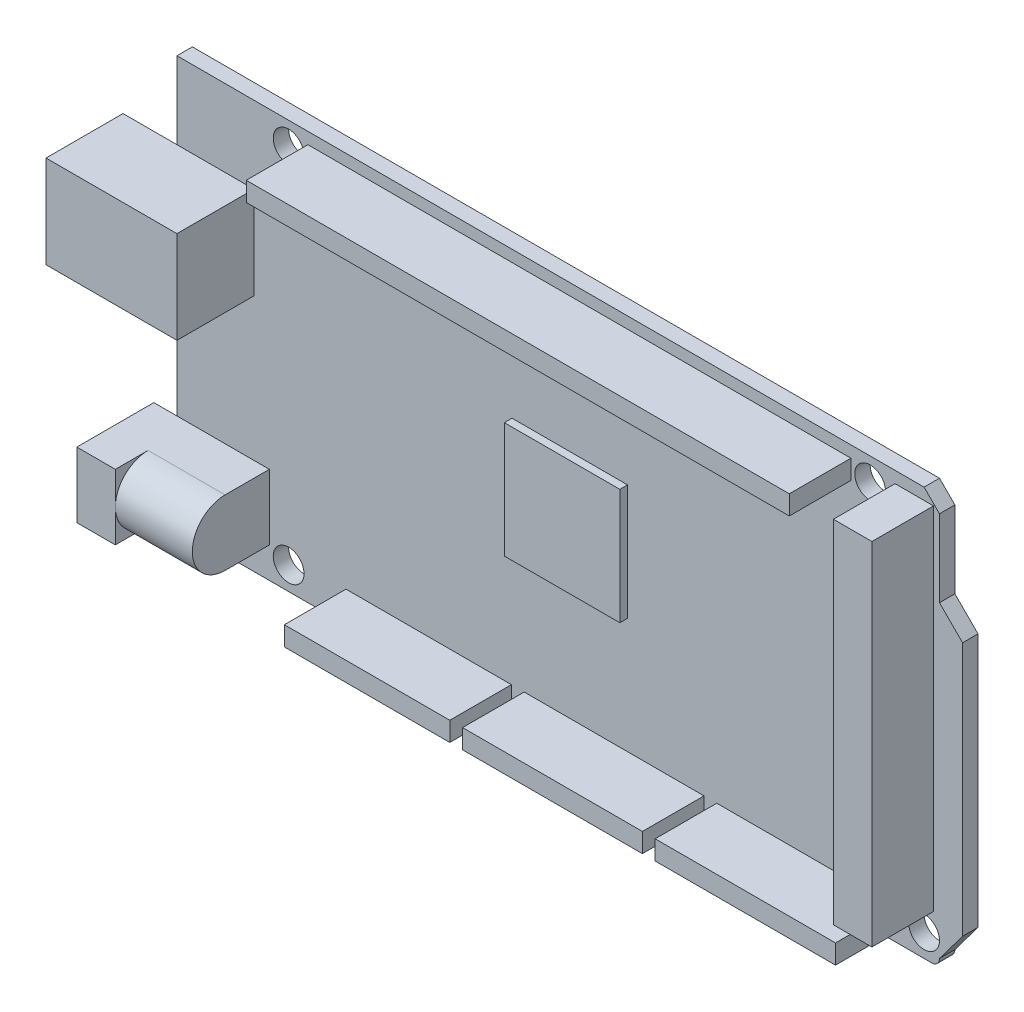
from build123d import *

# Parameters (mm, degrees)
SKETCH_2_W          = 102
SKETCH_2_H          = 53
EXTRUDE_1_DEPTH     = 2
CUT_EXTRUDE_1_DEPTH = 2
SKETCH_4_R          = 2
CUT_EXTRUDE_2_DEPTH = 2
FILLET_1_R          = 1
SKETCH_5_R          = 2
CUT_EXTRUDE_3_DEPTH = 2
SKETCH_6_W          = 17
SKETCH_6_H          = 12
EXTRUDE_2_DEPTH     = 10
SKETCH_7_W          = 70.5
SKETCH_7_H          = 2.5
SKETCH_7_W_2        = 5
SKETCH_7_H_2        = 45.597878471
SKETCH_7_W_3        = 71.552945179
EXTRUDE_3_DEPTH     = 8
SKETCH_8_W          = 15
SKETCH_8_H          = 15
EXTRUDE_4_DEPTH     = 1
SKETCH_9_W          = 1.65475178
SKETCH_9_H          = 2.5
CUT_EXTRUDE_4_DEPTH = 8
SKETCH_10_W         = 15
SKETCH_10_H         = 8.5
EXTRUDE_5_DEPTH     = 10
CUT_EXTRUDE_5_DEPTH = 10
SKETCH_12_R         = 3
SKETCH_12_R_2       = 0.5
CUT_EXTRUDE_6_DEPTH = 11
SKETCH_13_W         = 3
SKETCH_13_H         = 4
CUT_EXTRUDE_7_DEPTH = 11


with BuildPart() as part:
    # 草图2 → 凸台-拉伸1 (new body)
    with BuildSketch(Plane.XY):
        Rectangle(SKETCH_2_W, SKETCH_2_H)
    extrude(amount=EXTRUDE_1_DEPTH)

    # 草图3 → 切除-拉伸1 (cut)
    with BuildSketch(Plane.XY.offset(2)):
        Polygon((51, 11.5), (48, 14.5), (48, 24.5), (46, 26.5), (51, 26.5), align=None)
        Polygon((51, -21.5), (48, -25.5), (48, -26.5), (51, -26.5), align=None)
    extrude(amount=-CUT_EXTRUDE_1_DEPTH, mode=Mode.SUBTRACT)

    # 草图4 → 切除-拉伸2 (cut)
    with BuildSketch(Plane.XY.offset(2)):
        with Locations((46, -23.5)):
            Circle(SKETCH_4_R)
    extrude(amount=-CUT_EXTRUDE_2_DEPTH, mode=Mode.SUBTRACT)

    # 圆角1
    fillet_1_edges = [part.edges().sort_by_distance(p)[0] for p in [
        (48, -26.5, 1),
    ]]
    fillet(fillet_1_edges, radius=FILLET_1_R - 0.0001)  # a hair under: the kernel refuses the full size

    # 草图5 → 切除-拉伸3 (cut)
    with BuildSketch(Plane.XY.offset(2)):
        with Locations((39, 23.5)):
            Circle(SKETCH_5_R)
        with Locations((-36.5, 23.5)):
            Circle(SKETCH_5_R)
        with Locations(Location((-36.5, -23.5, 0), (0, 0, 180))):
            Circle(SKETCH_5_R)
    extrude(amount=-CUT_EXTRUDE_3_DEPTH, mode=Mode.SUBTRACT)

    # 草图6 → 凸台-拉伸2 (add)
    with BuildSketch(Plane.XY.offset(2)):
        with Locations((-49.5, 10.5)):
            Rectangle(SKETCH_6_W, SKETCH_6_H)
    extrude(amount=EXTRUDE_2_DEPTH)

    # 草图7 → 凸台-拉伸3 (add)
    with BuildSketch(Plane.XY.offset(2)):
        with Locations((1.25, 23.75)):
            Rectangle(SKETCH_7_W, SKETCH_7_H)
        with Locations((44.72661283, 2.201060764)):
            Rectangle(SKETCH_7_W_2, SKETCH_7_H_2)
        with Locations((6.72352741, -23.75)):
            Rectangle(SKETCH_7_W_3, SKETCH_7_H)
    extrude(amount=EXTRUDE_3_DEPTH)

    # 草图8 → 凸台-拉伸4 (add)
    with BuildSketch(Plane.XY.offset(2)):
        Rectangle(SKETCH_8_W, SKETCH_8_H)
    extrude(amount=EXTRUDE_4_DEPTH)

    # 草图9 → 切除-拉伸4 (cut)
    with BuildSketch(Plane.XY.offset(10)):
        with Locations((-6.746736472, -23.75)):
            Rectangle(SKETCH_9_W, SKETCH_9_H)
        with Locations((18.258401548, -23.75)):
            Rectangle(SKETCH_9_W, SKETCH_9_H)
    extrude(amount=-CUT_EXTRUDE_4_DEPTH, mode=Mode.SUBTRACT)

    # 草图10 → 凸台-拉伸5 (add)
    with BuildSketch(Plane.XY.offset(2)):
        with Locations((-46.5, -18.25)):
            Rectangle(SKETCH_10_W, SKETCH_10_H)
    extrude(amount=EXTRUDE_5_DEPTH)

    # 草图11 → 切除-拉伸5 (cut)
    with BuildSketch(Plane(origin=(-39, 0, 0), x_dir=(0, 0, -1), z_dir=(1, 0, 0))):
        with BuildLine():
            ThreePointArc((-7.75, -22.5), (-10.75520382, -21.25520382), (-12, -18.25))
            Line((-12, -18.25), (-12, -22.5))
            Line((-12, -22.5), (-7.75, -22.5))
        make_face()
        with BuildLine():
            Line((-7.75, -14), (-12, -14))
            Line((-12, -14), (-12, -18.25))
            ThreePointArc((-12, -18.25), (-10.75520382, -15.24479618), (-7.75, -14))
        make_face()
    extrude(amount=-CUT_EXTRUDE_5_DEPTH, mode=Mode.SUBTRACT)

    # 草图12 → 切除-拉伸6 (cut)
    with BuildSketch(Plane.ZY.offset(54)):
        with Locations((7.75, -18.25)):
            Circle(SKETCH_12_R)
        with Locations((7.75, -18.25)):
            Circle(SKETCH_12_R_2, mode=Mode.SUBTRACT)
    extrude(amount=-CUT_EXTRUDE_6_DEPTH, mode=Mode.SUBTRACT)

    # 草图13 → 切除-拉伸7 (cut)
    with BuildSketch(Plane.ZY.offset(58)):
        Polygon((11, 13.5), (9, 15.5), (3, 15.5), (3, 5.5), (9, 5.5), (11, 7.5), align=None)
        with Locations((7, 10.5)):
            Rectangle(SKETCH_13_W, SKETCH_13_H, mode=Mode.SUBTRACT)
    extrude(amount=-CUT_EXTRUDE_7_DEPTH, mode=Mode.SUBTRACT)


solid = part.part
